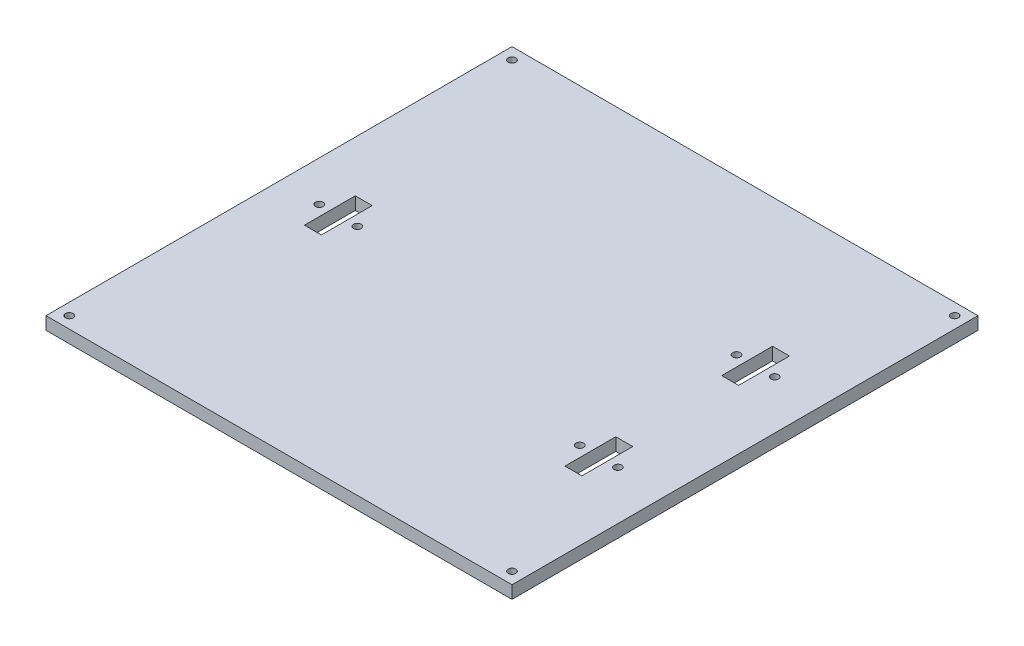
from build123d import *

# Parameters (mm, degrees)
SKETCH1_W           = 220
SKETCH1_H           = 220
SKETCH1_R           = 1.8
SKETCH1_W_2         = 8
SKETCH1_H_2         = 24
BOSS_EXTRUDE1_DEPTH = 3


with BuildPart() as part:
    # Sketch1 → Boss-Extrude1 (new, symmetric)
    with BuildSketch(Plane(origin=(0, 0, 0), x_dir=(1, 0, 0), z_dir=(0, 1, 0))):
        Rectangle(SKETCH1_W, SKETCH1_H)
        with Locations((-104.5, 104.5)):
            Circle(SKETCH1_R, mode=Mode.SUBTRACT)
        with Locations((104.5, 104.5)):
            Circle(SKETCH1_R, mode=Mode.SUBTRACT)
        with Locations((104.5, -104.5)):
            Circle(SKETCH1_R, mode=Mode.SUBTRACT)
        with Locations((-104.5, -104.5)):
            Circle(SKETCH1_R, mode=Mode.SUBTRACT)
        with Locations((-73, 0)):
            Circle(SKETCH1_R, mode=Mode.SUBTRACT)
        with Locations((-91, 0)):
            Circle(SKETCH1_R, mode=Mode.SUBTRACT)
        with Locations((87, 37)):
            Circle(SKETCH1_R, mode=Mode.SUBTRACT)
        with Locations((69, 37)):
            Circle(SKETCH1_R, mode=Mode.SUBTRACT)
        with Locations((87, -37)):
            Circle(SKETCH1_R, mode=Mode.SUBTRACT)
        with Locations((69, -37)):
            Circle(SKETCH1_R, mode=Mode.SUBTRACT)
        with Locations((-82, 0)):
            Rectangle(SKETCH1_W_2, SKETCH1_H_2, mode=Mode.SUBTRACT)
        with Locations((78, 37)):
            Rectangle(SKETCH1_W_2, SKETCH1_H_2, mode=Mode.SUBTRACT)
        with Locations((78, -37)):
            Rectangle(SKETCH1_W_2, SKETCH1_H_2, mode=Mode.SUBTRACT)
    extrude(amount=BOSS_EXTRUDE1_DEPTH, both=True)


solid = part.part
